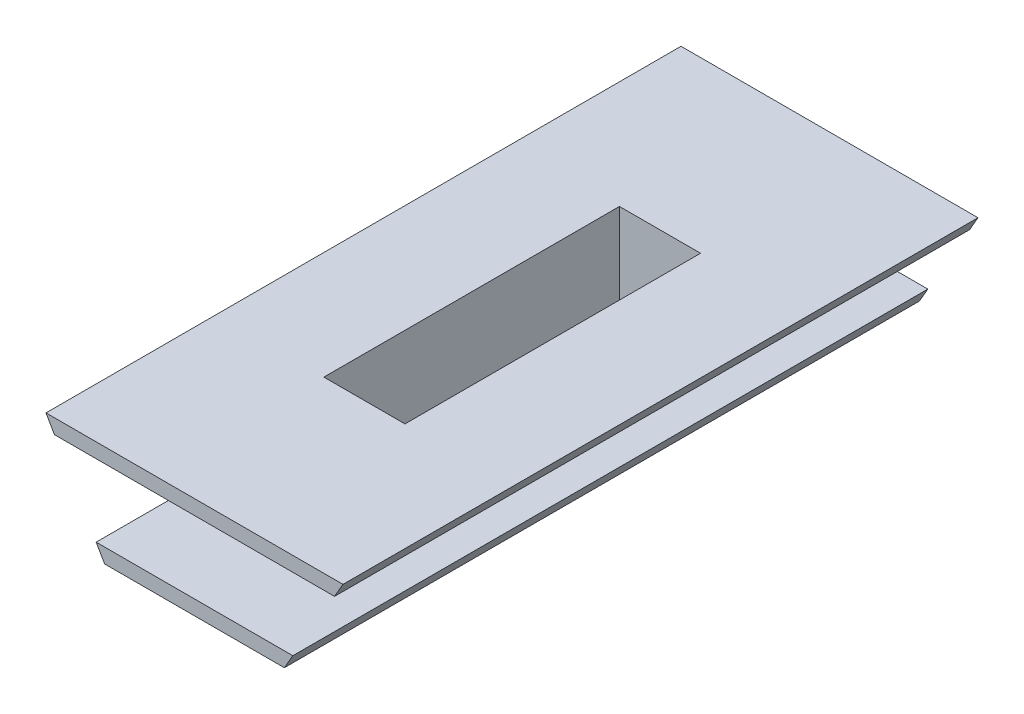
from build123d import *

# Parameters (mm, degrees)
BOSS_EXTRUDE2_DEPTH = 65
SKETCH10_W          = 10.3
SKETCH10_H          = 7.392395682
TOP_CUT_DEPTH       = 16.35
SKETCH11_W          = 10.3
SKETCH11_H          = 7.40522356
BOT_CUT_DEPTH       = 16.35
SKETCH13_W          = 8.3
SKETCH13_H          = 30.255654569
CUT_EXTRUDE8_DEPTH  = 68.55767906
FILLET1_R           = 1


with BuildPart() as part:
    # Casing → Boss-Extrude2 (new body)
    with BuildSketch(Plane.XY):
        Polygon((-9.2, 0), (9.2, 0), (10.066025404, 1.5), (5.15, 1.5), (5.15, 8.892304845), (14.333974596, 8.892304845), (15.2, 10.392304845), (-15.2, 10.392304845), (-14.333974596, 8.892304845), (-5.15, 8.892304845), (-5.15, 1.5), (-10.066025404, 1.5), align=None)
    extrude(amount=BOSS_EXTRUDE2_DEPTH)

    # Sketch10 → Top_Cut (cut)
    with BuildSketch(Plane.XY.offset(65)):
        with Locations((0, 5.196197841)):
            Rectangle(SKETCH10_W, SKETCH10_H)
    extrude(amount=-TOP_CUT_DEPTH, mode=Mode.SUBTRACT)

    # Sketch11 → Bot_Cut (cut)
    with BuildSketch(Plane(origin=(0, 0, 0), x_dir=(-1, 0, 0), z_dir=(0, 0, -1))):
        with Locations((0, 5.20261178)):
            Rectangle(SKETCH11_W, SKETCH11_H)
    extrude(amount=-BOT_CUT_DEPTH, mode=Mode.SUBTRACT)

    # Sketch13 → Cut-Extrude8 (cut, through all)
    with BuildSketch(Plane(origin=(0, 10.392304845, 0), x_dir=(1, 0, 0), z_dir=(0, 1, 0))):
        with Locations((0, -32.477827285)):
            Rectangle(SKETCH13_W, SKETCH13_H)
    extrude(amount=-CUT_EXTRUDE8_DEPTH, mode=Mode.SUBTRACT)

    # Fillet1
    fillet1_edges = [part.edges().sort_by_distance(p)[0] for p in [
        (-5.15, 5.196152423, 48.65),
        (5.15, 5.196152423, 48.65),
        (-5.15, 5.196152423, 16.35),
        (5.15, 5.196152423, 16.35),
    ]]
    fillet(fillet1_edges, radius=FILLET1_R)


solid = part.part
